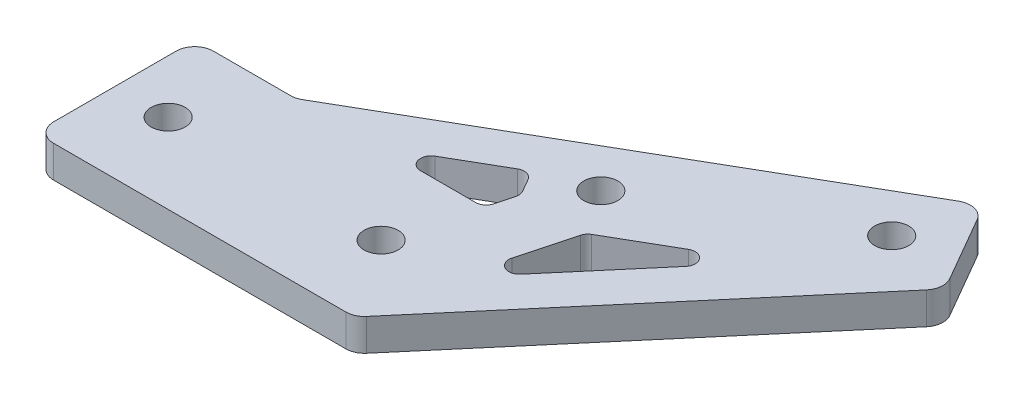
from build123d import *

# Parameters (mm, degrees)
SKETCH_2_R          = 1.6
EXTRUDE_1_DEPTH     = 1.5
CUT_EXTRUDE_1_DEPTH = 3
FILLET_1_R          = 1
FILLET_2_R          = 1.75


with BuildPart() as part:
    # ｽｹｯﾁ2 → ﾎﾞｽ - 押し出し1 (new, symmetric)
    with BuildSketch(Plane(origin=(0, 0, 0), x_dir=(1, 0, 0), z_dir=(0, 1, 0))):
        Polygon((24.47, 8.660254038), (9.47, 0), (0, 0), (0, -15), (30, -15), (55.450762114, 15), (50.450762114, 23.660254038), align=None)
        with Locations((48.620635095, 16.830127019)):
            Circle(SKETCH_2_R, mode=Mode.SUBTRACT)
        with Locations((25, -7.5)):
            Circle(SKETCH_2_R, mode=Mode.SUBTRACT)
        with Locations((31.300127019, 6.830127019)):
            Circle(SKETCH_2_R, mode=Mode.SUBTRACT)
        with Locations((5, -7.5)):
            Circle(SKETCH_2_R, mode=Mode.SUBTRACT)
    extrude(amount=EXTRUDE_1_DEPTH, both=True)

    # ｽｹｯﾁ3 → ｶｯﾄ - 押し出し1 (cut)
    with BuildSketch(Plane(origin=(0, 1.5, 0), x_dir=(1, 0, 0), z_dir=(0, 1, 0))):
        Polygon((31.44676478, -7.111500799), (45.169472556, 9.064094706), (34.062793268, 2.651650429), align=None)
        Polygon((26.47, 5.196152423), (17.47, 0), (27.140628594, 0), (27.879009742, 2.755675961), align=None)
    extrude(amount=-CUT_EXTRUDE_1_DEPTH, mode=Mode.SUBTRACT)

    # ﾌｨﾚｯﾄ1
    fillet_1_edges = [part.edges().sort_by_distance(p)[0] for p in [
        (45.169472556, 0, -9.064094706),
        (17.47, 0, 0),
        (26.47, 0, -5.196152423),
        (27.879009742, 0, -2.755675961),
        (27.140628594, 0, 0),
        (31.44676478, 0, 7.111500799),
        (34.062793268, 0, -2.651650429),
    ]]
    fillet(fillet_1_edges, radius=FILLET_1_R)

    # ﾌｨﾚｯﾄ2
    fillet_2_edges = [part.edges().sort_by_distance(p)[0] for p in [
        (50.450762114, 0, -23.660254038),
        (55.450762114, 0, -15),
        (30, 0, 15),
        (9.47, 0, 0),
        (0, 0, 0),
        (0, 0, 15),
    ]]
    fillet(fillet_2_edges, radius=FILLET_2_R)


solid = part.part
